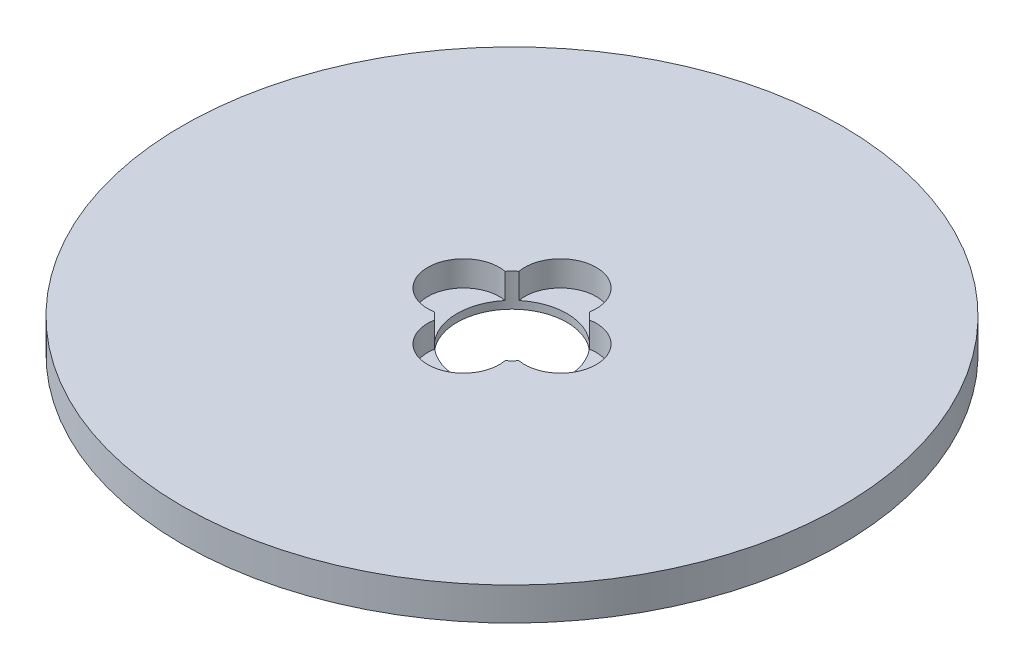
from build123d import *

# Parameters (mm, degrees)
SKETCH1_R           = 90
BOSS_EXTRUDE1_DEPTH = 9
SKETCH2_R           = 15
CUT_EXTRUDE1_DEPTH  = 128.597021909
SKETCH3_R           = 9.780980412
CUT_EXTRUDE2_DEPTH  = 6.906029705
CIRPATTERN1_COUNT   = 4


with BuildPart() as part:
    # Sketch1 → Boss-Extrude1 (new body)
    with BuildSketch(Plane(origin=(0, 0, 0), x_dir=(1, 0, 0), z_dir=(0, 1, 0))):
        Circle(SKETCH1_R)
    extrude(amount=BOSS_EXTRUDE1_DEPTH)

    # Sketch2 → Cut-Extrude1 (cut, through all)
    with BuildSketch(Plane(origin=(0, 0, 0), x_dir=(1, 0, 0), z_dir=(0, 1, 0))):
        Circle(SKETCH2_R)
    extrude(amount=CUT_EXTRUDE1_DEPTH, mode=Mode.SUBTRACT)

    # Sketch3 → Cut-Extrude2 (cut)
    with BuildSketch(Plane(origin=(0, 9, 0), x_dir=(1, 0, 0), z_dir=(0, 1, 0))):
        with Locations((-13.231011607, 0)):
            Circle(SKETCH3_R)
    cut_extrude2 = extrude(amount=-CUT_EXTRUDE2_DEPTH, mode=Mode.SUBTRACT)

    # CirPattern1: Cut-Extrude2 ×4 about axis
    cirpattern1_axis = Axis((0, 0, 0), (0, 1, 0))
    for i in range(1, CIRPATTERN1_COUNT):
        add(cut_extrude2.rotate(cirpattern1_axis, i * 360 / CIRPATTERN1_COUNT), mode=Mode.SUBTRACT)


solid = part.part
